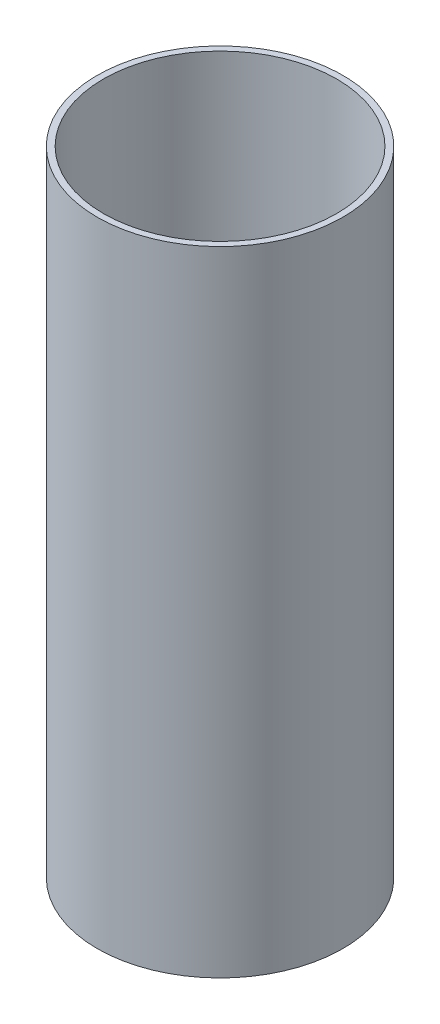
from build123d import *

# Parameters (mm, degrees)
SKETCH1_R           = 93.6625
SKETCH1_R_2         = 88.9
BOSS_EXTRUDE1_DEPTH = 241.427


with BuildPart() as part:
    # Sketch1 → Boss-Extrude1 (new, symmetric)
    with BuildSketch(Plane(origin=(0, 0, 0), x_dir=(1, 0, 0), z_dir=(0, 1, 0))):
        Circle(SKETCH1_R)
        Circle(SKETCH1_R_2, mode=Mode.SUBTRACT)
    extrude(amount=BOSS_EXTRUDE1_DEPTH, both=True)


solid = part.part
